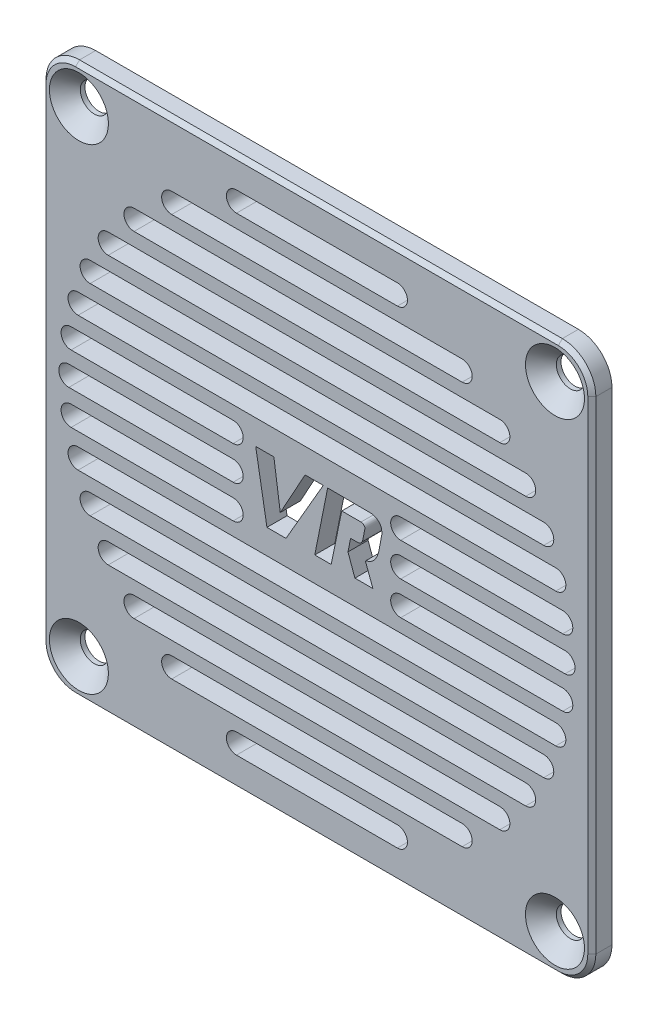
from build123d import *

# Parameters (mm, degrees)
SKETCH1_R     = 2.1
BASE_DEPTH    = 3
CHAMFER1_SIZE = 2.3
LOGO_DEPTH    = 59.060313468
HOLES_DEPTH   = 59.060313614
CHAMFER2_SIZE = 0.6


with BuildPart() as part:
    # Sketch1 → Base (new body)
    with BuildSketch(Plane.XY):
        with BuildLine():
            Line((41, -36), (41, 36))
            ThreePointArc((41, 36), (39.535533906, 39.535533906), (36, 41))
            Line((36, 41), (-36, 41))
            ThreePointArc((-36, 41), (-39.535533906, 39.535533906), (-41, 36))
            Line((-41, 36), (-41, -36))
            ThreePointArc((-41, -36), (-39.535533906, -39.535533906), (-36, -41))
            Line((-36, -41), (36, -41))
            ThreePointArc((36, -41), (39.535533906, -39.535533906), (41, -36))
        make_face()
        with Locations((-35.5, -35.5)):
            Circle(SKETCH1_R, mode=Mode.SUBTRACT)
        with Locations((35.5, -35.5)):
            Circle(SKETCH1_R, mode=Mode.SUBTRACT)
        with Locations((-35.5, 35.5)):
            Circle(SKETCH1_R, mode=Mode.SUBTRACT)
        with Locations((35.5, 35.5)):
            Circle(SKETCH1_R, mode=Mode.SUBTRACT)
    extrude(amount=BASE_DEPTH)

    # Chamfer1
    chamfer1_edges = [part.edges().sort_by_distance(p)[0] for p in [
        (33.4, -35.5, 3),
        (-37.6, -35.5, 3),
        (33.4, 35.5, 3),
        (-37.6, 35.5, 3),
    ]]
    chamfer(chamfer1_edges, length=CHAMFER1_SIZE)

    # Sketch3 → Logo (cut, through all)
    with BuildSketch(Plane.XY.offset(3)):
        Polygon((0.943772225, 4.807339306), (-1.770278146, 4.807339306), (-5.467106691, -1.899839555), (-6.421148406, 4.807339306), (-9.131384374, 4.807339306), (-7.454751896, -4.81111301), (-4.6161142, -4.81111301), align=None)
        with BuildLine():
            Line((3.703527881, 2.889834342), (6.573462709, 2.889834342))
            add(Edge.make_bspline(
                [(6.573462709, 2.889834342), (6.639918683, 2.878954155), (6.706374657, 2.868073967), (6.772830631, 2.857193779), (6.786633549, 2.854933962), (6.814239384, 2.850414328), (6.855551453, 2.832372294), (6.876790416, 2.814167468), (6.887409897, 2.805065055), (6.919492092, 2.777566032), (6.951574286, 2.750067008), (6.983656481, 2.722567984), (6.993167085, 2.714416037), (7.012188295, 2.698112144), (7.038593103, 2.66998605), (7.051500973, 2.648514901), (7.057954908, 2.637779327), (7.075404999, 2.60875258), (7.092855089, 2.579725832), (7.11030518, 2.550699085), (7.116791727, 2.539909264), (7.12976482, 2.518329621), (7.136480315, 2.478226939), (7.136480315, 2.453047938), (7.136480315, 2.440458437), (7.136480315, 2.395991418), (7.136480315, 2.3515244), (7.136480315, 2.307057382), (7.136480315, 2.292302161), (7.136480315, 2.262791718), (7.132234446, 2.218327427), (7.1266495, 2.189350288), (7.123857028, 2.174861718), (7.033719, 1.707186218), (6.943580973, 1.239510717), (6.853442946, 0.771835216), (6.850303902, 0.755548486), (6.844025815, 0.722975025), (6.831361308, 0.674631499), (6.820862573, 0.643163717), (6.815613205, 0.627429826), (6.799830938, 0.580125754), (6.784048672, 0.532821683), (6.768266405, 0.485517611), (6.763799932, 0.472130285), (6.754866986, 0.445355633), (6.73663685, 0.405279323), (6.71826793, 0.383848917), (6.70908347, 0.373133714), (6.685410448, 0.345515187), (6.661737425, 0.317896661), (6.638064403, 0.290278135), (6.630063422, 0.280943658), (6.614061462, 0.262274704), (6.587939681, 0.235980407), (6.569486158, 0.219730482), (6.560259397, 0.21160552), (6.532062416, 0.186775636), (6.503865435, 0.161945752), (6.475668454, 0.137115868), (6.465349713, 0.128029323), (6.44471223, 0.109856232), (6.406036938, 0.091012836), (6.379877632, 0.08253595), (6.366797978, 0.078297507), (6.300222974, 0.05672397), (6.23364797, 0.035150434), (6.167072966, 0.013576897)],
                knots=[0, 0, 0, 0, 0.0565978, 0.0565978, 0.0565978, 0.068353174, 0.080108547, 0.09186392, 0.09186392, 0.09186392, 0.127377722, 0.127377722, 0.127377722, 0.13790561, 0.148433497, 0.158961384, 0.158961384, 0.158961384, 0.18742659, 0.18742659, 0.18742659, 0.198007674, 0.208588759, 0.219169844, 0.219169844, 0.219169844, 0.256542993, 0.256542993, 0.256542993, 0.268944298, 0.281345604, 0.29374691, 0.29374691, 0.29374691, 0.694047762, 0.694047762, 0.694047762, 0.70798818, 0.721928599, 0.735869017, 0.735869017, 0.735869017, 0.777780999, 0.777780999, 0.777780999, 0.789642332, 0.801503665, 0.813364999, 0.813364999, 0.813364999, 0.843937685, 0.843937685, 0.843937685, 0.854270606, 0.864603526, 0.874936447, 0.874936447, 0.874936447, 0.90651385, 0.90651385, 0.90651385, 0.918069663, 0.929625477, 0.94118129, 0.94118129, 0.94118129, 1, 1, 1, 1], degree=3))
            Line((6.167072966, 0.013576897), (5.021039356, 0.013576897))
            Line((5.021039356, 0.013576897), (4.631352863, -1.934855565))
            Line((4.631352863, -1.934855565), (5.663053903, -4.81111301))
            Line((5.663053903, -4.81111301), (8.342652792, -4.81111301))
            Line((8.342652792, -4.81111301), (7.229262814, -1.811145568))
            add(Edge.make_bspline(
                [(9.229165365, 0.414561503), (9.120168623, 0.017200275), (8.915302455, -0.554839168), (8.44639111, -1.160174748), (7.942619292, -1.563122791), (7.499335661, -1.705024341), (7.229262814, -1.811145568)],
                knots=[0, 0, 0, 0, 0.394088826, 0.566272378, 0.72213611, 1, 1, 1, 1], degree=3))
            Line((9.229165365, 0.414561503), (9.678442486, 2.846313591))
            add(Edge.make_bspline(
                [(9.678442486, 2.846313591), (9.687044519, 2.989216011), (9.687308007, 3.219249114), (9.634056055, 3.573555205), (9.530960339, 3.877016599), (9.318991652, 4.174966565), (9.058914286, 4.416757541), (8.748200867, 4.611244982), (8.404818025, 4.732990617), (8.163573675, 4.770595689), (8.033377798, 4.776411806)],
                knots=[0, 0, 0, 0, 0.150297951, 0.240095534, 0.375313148, 0.481557048, 0.620389709, 0.745312315, 0.863340897, 1, 1, 1, 1], degree=3))
            Line((8.033377798, 4.776411806), (1.600457921, 4.807339306))
            Line((1.600457921, 4.807339306), (-0.323232542, -4.81111301))
            Line((-0.323232542, -4.81111301), (2.126225411, -4.81111301))
            Line((2.126225411, -4.81111301), (3.703527881, 2.889834342))
        make_face()
    extrude(amount=-LOGO_DEPTH, mode=Mode.SUBTRACT)

    # Sketch4 → Holes (cut, through all)
    with BuildSketch(Plane.XY.offset(3)):
        with BuildLine():
            Line((-33.823069051, 13.5), (33.823069051, 13.5))
            ThreePointArc((33.823069051, 13.5), (35.323069051, 15), (33.823069051, 16.5))
            Line((33.823069051, 16.5), (-33.823069051, 16.5))
            ThreePointArc((-33.823069051, 16.5), (-35.323069051, 15), (-33.823069051, 13.5))
        make_face()
        with BuildLine():
            Line((-35.623026261, 8.5), (35.623026261, 8.5))
            ThreePointArc((35.623026261, 8.5), (37.123026261, 10), (35.623026261, 11.5))
            Line((35.623026261, 11.5), (-35.623026261, 11.5))
            ThreePointArc((-35.623026261, 11.5), (-37.123026261, 10), (-35.623026261, 8.5))
        make_face()
        with BuildLine():
            Line((-36.66060556, 3.5), (-12.5, 3.5))
            ThreePointArc((-12.5, 3.5), (-11, 5), (-12.5, 6.5))
            Line((-12.5, 6.5), (-36.66060556, 6.5))
            ThreePointArc((-36.66060556, 6.5), (-38.16060556, 5), (-36.66060556, 3.5))
        make_face()
        with BuildLine():
            Line((-36.66060556, -6.5), (-12.5, -6.5))
            ThreePointArc((-12.5, -6.5), (-11, -5), (-12.5, -3.5))
            Line((-12.5, -3.5), (-36.66060556, -3.5))
            ThreePointArc((-36.66060556, -3.5), (-38.16060556, -5), (-36.66060556, -6.5))
        make_face()
        with BuildLine():
            Line((-35.623026261, -11.5), (35.623026261, -11.5))
            ThreePointArc((35.623026261, -11.5), (37.123026261, -10), (35.623026261, -8.5))
            Line((35.623026261, -8.5), (-35.623026261, -8.5))
            ThreePointArc((-35.623026261, -8.5), (-37.123026261, -10), (-35.623026261, -11.5))
        make_face()
        with BuildLine():
            Line((-33.823069051, -16.5), (33.823069051, -16.5))
            ThreePointArc((33.823069051, -16.5), (35.323069051, -15), (33.823069051, -13.5))
            Line((33.823069051, -13.5), (-33.823069051, -13.5))
            ThreePointArc((-33.823069051, -13.5), (-35.323069051, -15), (-33.823069051, -16.5))
        make_face()
        with BuildLine():
            Line((12.5, -6.5), (36.66060556, -6.5))
            ThreePointArc((36.66060556, -6.5), (38.16060556, -5), (36.66060556, -3.5))
            Line((36.66060556, -3.5), (12.5, -3.5))
            ThreePointArc((12.5, -3.5), (11, -5), (12.5, -6.5))
        make_face()
        with BuildLine():
            Line((12.5, 3.5), (36.66060556, 3.5))
            ThreePointArc((36.66060556, 3.5), (38.16060556, 5), (36.66060556, 6.5))
            Line((36.66060556, 6.5), (12.5, 6.5))
            ThreePointArc((12.5, 6.5), (11, 5), (12.5, 3.5))
        make_face()
        with BuildLine():
            Line((-37, -1.5), (-12.5, -1.5))
            ThreePointArc((-12.5, -1.5), (-11, 0), (-12.5, 1.5))
            Line((-12.5, 1.5), (-37, 1.5))
            ThreePointArc((-37, 1.5), (-38.5, 0), (-37, -1.5))
        make_face()
        with BuildLine():
            Line((12.5, -1.5), (37, -1.5))
            ThreePointArc((37, -1.5), (38.5, 0), (37, 1.5))
            Line((37, 1.5), (12.5, 1.5))
            ThreePointArc((12.5, 1.5), (11, 0), (12.5, -1.5))
        make_face()
        with BuildLine():
            Line((-31.128764833, 18.5), (31.128764833, 18.5))
            ThreePointArc((31.128764833, 18.5), (32.628764833, 20), (31.128764833, 21.5))
            Line((31.128764833, 21.5), (-31.128764833, 21.5))
            ThreePointArc((-31.128764833, 21.5), (-32.628764833, 20), (-31.128764833, 18.5))
        make_face()
        with BuildLine():
            Line((-27.276363394, 23.5), (27.276363394, 23.5))
            ThreePointArc((27.276363394, 23.5), (28.776363394, 25), (27.276363394, 26.5))
            Line((27.276363394, 26.5), (-27.276363394, 26.5))
            ThreePointArc((-27.276363394, 26.5), (-28.776363394, 25), (-27.276363394, 23.5))
        make_face()
        with BuildLine():
            Line((-21.656407828, 28.5), (21.656407828, 28.5))
            ThreePointArc((21.656407828, 28.5), (23.156407828, 30), (21.656407828, 31.5))
            Line((21.656407828, 31.5), (-21.656407828, 31.5))
            ThreePointArc((-21.656407828, 31.5), (-23.156407828, 30), (-21.656407828, 28.5))
        make_face()
        with BuildLine():
            Line((-12, 33.5), (12, 33.5))
            ThreePointArc((12, 33.5), (13.5, 35), (12, 36.5))
            Line((12, 36.5), (-12, 36.5))
            ThreePointArc((-12, 36.5), (-13.5, 35), (-12, 33.5))
        make_face()
        with BuildLine():
            ThreePointArc((31.128764833, -18.5), (32.628764833, -20), (31.128764833, -21.5))
            Line((31.128764833, -21.5), (-31.128764833, -21.5))
            ThreePointArc((-31.128764833, -21.5), (-32.628764833, -20), (-31.128764833, -18.5))
            Line((-31.128764833, -18.5), (31.128764833, -18.5))
        make_face()
        with BuildLine():
            ThreePointArc((27.276363394, -23.5), (28.776363394, -25), (27.276363394, -26.5))
            Line((27.276363394, -26.5), (-27.276363394, -26.5))
            ThreePointArc((-27.276363394, -26.5), (-28.776363394, -25), (-27.276363394, -23.5))
            Line((-27.276363394, -23.5), (27.276363394, -23.5))
        make_face()
        with BuildLine():
            ThreePointArc((21.656407828, -28.5), (23.156407828, -30), (21.656407828, -31.5))
            Line((21.656407828, -31.5), (-21.656407828, -31.5))
            ThreePointArc((-21.656407828, -31.5), (-23.156407828, -30), (-21.656407828, -28.5))
            Line((-21.656407828, -28.5), (21.656407828, -28.5))
        make_face()
        with BuildLine():
            ThreePointArc((12, -33.5), (13.5, -35), (12, -36.5))
            Line((12, -36.5), (-12, -36.5))
            ThreePointArc((-12, -36.5), (-13.5, -35), (-12, -33.5))
            Line((-12, -33.5), (12, -33.5))
        make_face()
    extrude(amount=-HOLES_DEPTH, mode=Mode.SUBTRACT)

    # Chamfer2
    chamfer2_edges = [part.edges().sort_by_distance(p)[0] for p in [
        (0, -41, 3),
        (-39.535533906, -39.535533906, 3),
        (39.535533906, -39.535533906, 3),
        (-41, 0, 3),
        (41, 0, 3),
        (-39.535533906, 39.535533906, 3),
        (39.535533906, 39.535533906, 3),
        (0, 41, 3),
    ]]
    chamfer(chamfer2_edges, length=CHAMFER2_SIZE)


solid = part.part
